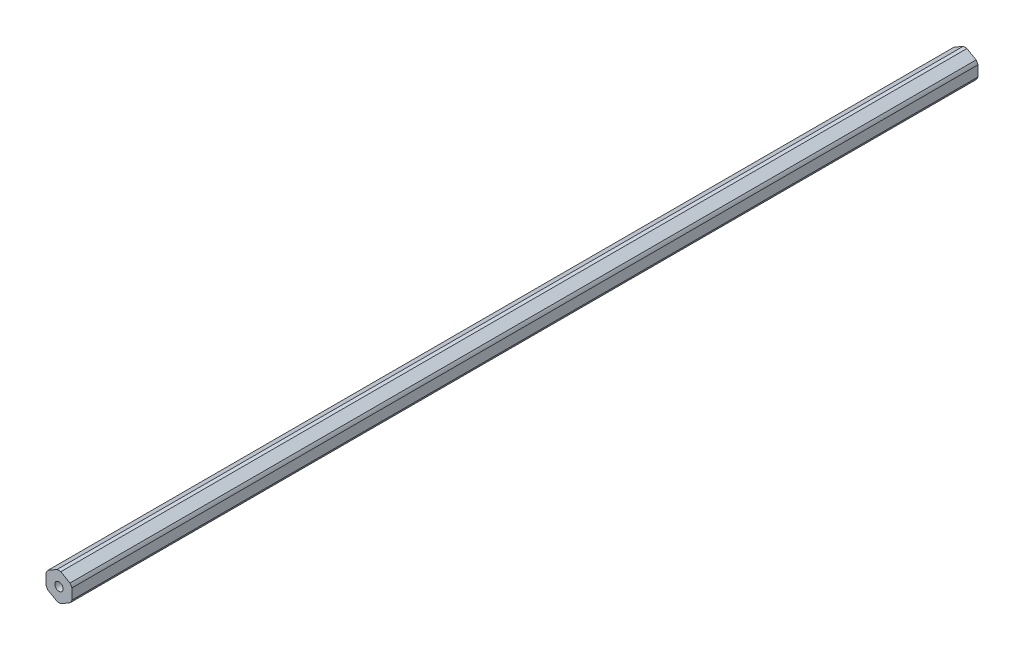
from build123d import *

# Parameters (mm, degrees)
BOSS_EXTRUDE1_DEPTH                  = 222.25
F_10_32_TAPPED_HOLE1_D               = 4.0386
F_10_32_TAPPED_HOLE1_DEPTH           = 15.07744
F_10_32_TAPPED_HOLE1_TIP             = 1.213317848
F_10_32_TAPPED_HOLE1_ON_FACE_2_D     = 4.0386
F_10_32_TAPPED_HOLE1_ON_FACE_2_DEPTH = 15.07744
F_10_32_TAPPED_HOLE1_ON_FACE_2_TIP   = 1.213317848


with BuildPart() as part:
    # Sketch1 → Boss-Extrude1 (new, symmetric)
    with BuildSketch(Plane.XY):
        with BuildLine():
            ThreePointArc((6.35, 2.590301913), (5.939202219, 3.429), (5.41826726, 4.204110358))
            Line((5.41826726, 4.204110358), (0.93173274, 6.79441227))
            ThreePointArc((0.93173274, 6.79441227), (0, 6.858), (-0.93173274, 6.79441227))
            Line((-0.93173274, 6.79441227), (-5.41826726, 4.204110358))
            ThreePointArc((-5.41826726, 4.204110358), (-5.939202219, 3.429), (-6.35, 2.590301913))
            Line((-6.35, 2.590301913), (-6.35, -2.590301913))
            ThreePointArc((-6.35, -2.590301913), (-5.939202219, -3.429), (-5.41826726, -4.204110358))
            Line((-5.41826726, -4.204110358), (-0.93173274, -6.79441227))
            ThreePointArc((-0.93173274, -6.79441227), (0, -6.858), (0.93173274, -6.79441227))
            Line((0.93173274, -6.79441227), (5.41826726, -4.204110358))
            ThreePointArc((5.41826726, -4.204110358), (5.939202219, -3.429), (6.35, -2.590301913))
            Line((6.35, -2.590301913), (6.35, 2.590301913))
        make_face()
    extrude(amount=BOSS_EXTRUDE1_DEPTH, both=True)

    # #10-32 Tapped Hole1
    with Locations(Plane.XY.offset(222.25)):
        with Locations((0, 0)):
            Hole(F_10_32_TAPPED_HOLE1_D / 2, depth=F_10_32_TAPPED_HOLE1_DEPTH)
            with Locations((0, 0, -(F_10_32_TAPPED_HOLE1_DEPTH + F_10_32_TAPPED_HOLE1_TIP / 2))):  # 118° drill point
                Cone(0, F_10_32_TAPPED_HOLE1_D / 2, F_10_32_TAPPED_HOLE1_TIP, mode=Mode.SUBTRACT)

    # #10-32 Tapped Hole1 on face 2
    with Locations(Plane(origin=(0, 0, -222.25), x_dir=(-1, 0, 0), z_dir=(0, 0, -1))):
        with Locations((0, 0)):
            Hole(F_10_32_TAPPED_HOLE1_ON_FACE_2_D / 2, depth=F_10_32_TAPPED_HOLE1_ON_FACE_2_DEPTH)
            with Locations((0, 0, -(F_10_32_TAPPED_HOLE1_ON_FACE_2_DEPTH + F_10_32_TAPPED_HOLE1_ON_FACE_2_TIP / 2))):  # 118° drill point
                Cone(0, F_10_32_TAPPED_HOLE1_ON_FACE_2_D / 2, F_10_32_TAPPED_HOLE1_ON_FACE_2_TIP, mode=Mode.SUBTRACT)


solid = part.part
